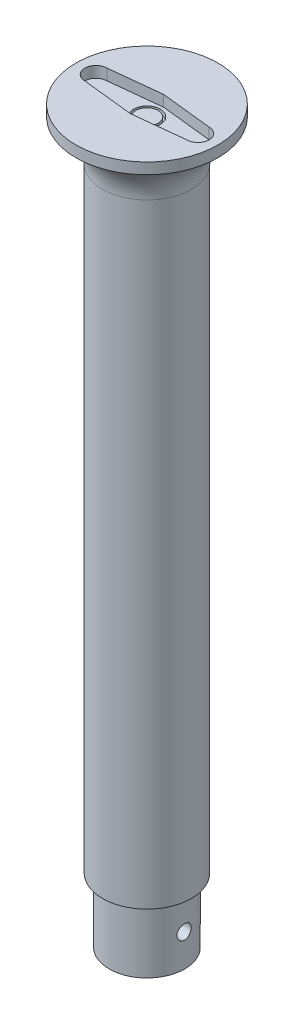
from build123d import *

# Parameters (mm, degrees)
SKETCH1_R               = 10
BOSS_EXTRUDE1_DEPTH     = 150
SKETCH2_R               = 8.5
SKETCH2_R_2             = 4.5
BOSS_EXTRUDE2_DEPTH     = 14.5
CUT_EXTRUDE1_DEPTH      = 14.5
CUT_EXTRUDE1_DEPTH_BACK = 14.5
SKETCH3_R               = 1.6
SKETCH5_R               = 16
BOSS_EXTRUDE3_DEPTH     = 2.5
FILLET1_R               = 10
CUT_EXTRUDE2_DEPTH      = 2.5
SKETCH6_R               = 3
SKETCH6_R_2             = 2.5
CUT_EXTRUDE3_DEPTH      = 1


with BuildPart() as part:
    # Sketch1 → Boss-Extrude1 (new body)
    with BuildSketch(Plane(origin=(0, 0, 0), x_dir=(1, 0, 0), z_dir=(0, 1, 0))):
        with Locations(Location((0, 0, 0), (0, 0, 270))):
            Circle(SKETCH1_R)
    extrude(amount=BOSS_EXTRUDE1_DEPTH)

    # Sketch2 → Boss-Extrude2 (add)
    with BuildSketch(Plane.XZ):
        with Locations(Location((0, 0, 0), (0, 0, 90))):
            Circle(SKETCH2_R)
        with Locations(Location((0, 0, 0), (0, 0, 90))):
            Circle(SKETCH2_R_2, mode=Mode.SUBTRACT)
    extrude(amount=BOSS_EXTRUDE2_DEPTH)

    # Sketch3 → Cut-Extrude1 (cut, two sides: drawn at the far end of the back side and taken through both)
    with BuildSketch(Plane(origin=(0, 0, 0), x_dir=(0, 0, -1), z_dir=(1, 0, 0)).offset(-CUT_EXTRUDE1_DEPTH_BACK)):
        with Locations(Location((0, -7.25, 0), (0, 0, 180))):
            Circle(SKETCH3_R)
    extrude(amount=CUT_EXTRUDE1_DEPTH + CUT_EXTRUDE1_DEPTH_BACK, mode=Mode.SUBTRACT)

    # Sketch5 → Boss-Extrude3 (add)
    with BuildSketch(Plane(origin=(0, 150, 0), x_dir=(1, 0, 0), z_dir=(0, 1, 0))):
        with Locations(Location((0, 0, 0), (0, 0, 270))):
            Circle(SKETCH5_R)
    extrude(amount=-BOSS_EXTRUDE3_DEPTH)

    # Fillet1
    # the kernel refuses this fillet: 10 mm, written as the material it adds along each edge
    with BuildSketch(Plane(origin=(0, 147.5, 0), x_dir=(0, 0, 1), z_dir=(1, 0, 0))) as fillet1_piece_1:
        with BuildLine():
            CenterArc((20, 9.16515139), FILLET1_R, 180, 66.421821522)
            Line((16, 0), (15.92, -0.183303028))
            ThreePointArc((15.92, -0.183303028), (13, -0.2), (10, -0.2))
            Line((10, -0.2), (9.8, 0))
            Line((9.8, 0), (9.8, 9.16515139))
            Line((9.8, 9.16515139), (10, 9.16515139))
        make_face()
    revolve(axis=Axis((0, 147.5, 0), (0, -1, 0)))

    # Sketch4 → Cut-Extrude2 (cut)
    with BuildSketch(Plane(origin=(0, 150, 0), x_dir=(1, 0, 0), z_dir=(0, 1, 0))):
        with BuildLine():
            ThreePointArc((-11.5, 2.5), (-13.267766953, 1.767766953), (-14, 0))
            Line((-14, 0), (-9, 0))
            ThreePointArc((-9, 0), (-9.732233047, 1.767766953), (-11.5, 2.5))
        make_face()
        with BuildLine():
            Line((-9, 0), (-14, 0))
            ThreePointArc((-14, 0), (-13.267766953, -1.767766953), (-11.5, -2.5))
            ThreePointArc((-11.5, -2.5), (-9.732233047, -1.767766953), (-9, 0))
        make_face()
        with BuildLine():
            Line((-3.75, 0), (-9, 0))
            ThreePointArc((-9, 0), (-9.732233047, -1.767766953), (-11.5, -2.5))
            Line((-11.5, -2.5), (-0.805698272, -3.662424101))
            ThreePointArc((-0.805698272, -3.662424101), (-2.922658766, -2.349588419), (-3.75, 0))
        make_face()
        with BuildLine():
            ThreePointArc((-11.5, 2.5), (-9.732233047, 1.767766953), (-9, 0))
            Line((-9, 0), (-3.75, 0))
            ThreePointArc((-3.75, 0), (-2.922658766, 2.349588419), (-0.805698272, 3.662424101))
            Line((-0.805698272, 3.662424101), (-11.5, 2.5))
        make_face()
        with BuildLine():
            ThreePointArc((-0.805698272, 3.662424101), (-2.922658766, 2.349588419), (-3.75, 0))
            Line((-3.75, 0), (0, 0))
            Line((0, 0), (0, 3.75))
            Line((0, 3.75), (-0.805698272, 3.662424101))
        make_face()
        with BuildLine():
            Line((0, 0), (-3.75, 0))
            ThreePointArc((-3.75, 0), (-2.922658766, -2.349588419), (-0.805698272, -3.662424101))
            Line((-0.805698272, -3.662424101), (0, -3.75))
            Line((0, -3.75), (0.805698272, -3.662424101))
            ThreePointArc((0.805698272, -3.662424101), (2.922658766, -2.349588419), (3.75, 0))
            Line((3.75, 0), (0, 0))
        make_face()
        with BuildLine():
            Line((0, 3.75), (0, 0))
            Line((0, 0), (3.75, 0))
            ThreePointArc((3.75, 0), (2.922658766, 2.349588419), (0.805698272, 3.662424101))
            Line((0.805698272, 3.662424101), (0, 3.75))
        make_face()
        with BuildLine():
            ThreePointArc((0.805698272, 3.662424101), (2.922658766, 2.349588419), (3.75, 0))
            Line((3.75, 0), (9, 0))
            ThreePointArc((9, 0), (9.732233047, 1.767766953), (11.5, 2.5))
            Line((11.5, 2.5), (0.805698272, 3.662424101))
        make_face()
        with BuildLine():
            Line((9, 0), (3.75, 0))
            ThreePointArc((3.75, 0), (2.922658766, -2.349588419), (0.805698272, -3.662424101))
            Line((0.805698272, -3.662424101), (11.5, -2.5))
            ThreePointArc((11.5, -2.5), (9.732233047, -1.767766953), (9, 0))
        make_face()
        with BuildLine():
            ThreePointArc((11.5, 2.5), (9.732233047, 1.767766953), (9, 0))
            Line((9, 0), (11.5, 0))
            Line((11.5, 0), (11.5, 2.5))
        make_face()
        with BuildLine():
            Line((11.5, 0), (9, 0))
            ThreePointArc((9, 0), (9.732233047, -1.767766953), (11.5, -2.5))
            Line((11.5, -2.5), (11.5, 0))
        make_face()
        with BuildLine():
            ThreePointArc((14, 0), (13.267766953, 1.767766953), (11.5, 2.5))
            Line((11.5, 2.5), (11.5, 0))
            Line((11.5, 0), (14, 0))
        make_face()
        with BuildLine():
            Line((11.5, 0), (11.5, -2.5))
            ThreePointArc((11.5, -2.5), (13.267766953, -1.767766953), (14, 0))
            Line((14, 0), (11.5, 0))
        make_face()
    extrude(amount=-CUT_EXTRUDE2_DEPTH, mode=Mode.SUBTRACT)

    # Sketch6 → Cut-Extrude3 (cut)
    with BuildSketch(Plane(origin=(0, 147.5, 0), x_dir=(1, 0, 0), z_dir=(0, 1, 0))):
        with Locations(Location((0, 0, 0), (0, 0, 270))):
            Circle(SKETCH6_R)
        with Locations(Location((0, 0, 0), (0, 0, 270))):
            Circle(SKETCH6_R_2, mode=Mode.SUBTRACT)
    extrude(amount=-CUT_EXTRUDE3_DEPTH, mode=Mode.SUBTRACT)


solid = part.part
